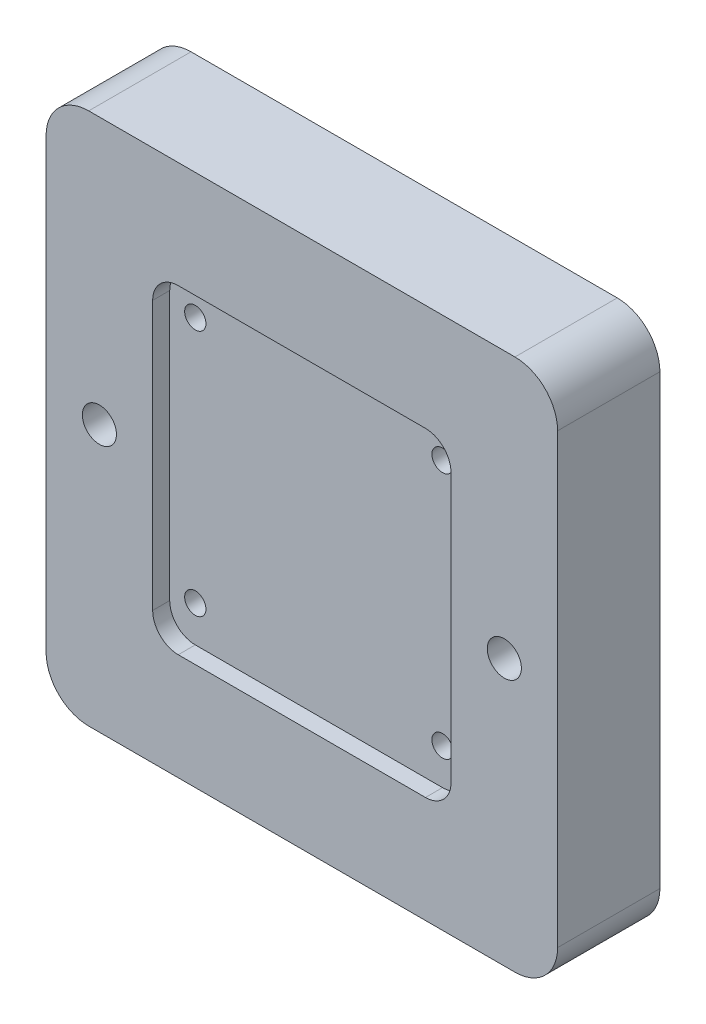
from build123d import *

# Parameters (mm, degrees)
BOSS_EXTRUDE1_DEPTH             = 4
BOSS_EXTRUDE2_DEPTH             = 20
F_8_0MM_DOWEL_HOLE1_D           = 8
F_8_0MM_DOWEL_HOLE1_DEPTH       = 18
F_8_0MM_DOWEL_HOLE1_TIP         = 2.403442476
TAP_DRILL_FOR_M6X1_0_TAP1_D     = 5
TAP_DRILL_FOR_M6X1_0_TAP1_DEPTH = 10
TAP_DRILL_FOR_M6X1_0_TAP1_TIP   = 1.502151548


with BuildPart() as part:
    # Sketch1 → Boss-Extrude1 (new body)
    with BuildSketch(Plane.XY):
        with BuildLine():
            Line((-50, 62.5), (50, 62.5))
            ThreePointArc((50, 62.5), (57.071067812, 59.571067812), (60, 52.5))
            Line((60, 52.5), (60, -52.5))
            ThreePointArc((60, -52.5), (57.071067812, -59.571067812), (50, -62.5))
            Line((50, -62.5), (-50, -62.5))
            ThreePointArc((-50, -62.5), (-57.071067812, -59.571067812), (-60, -52.5))
            Line((-60, -52.5), (-60, 52.5))
            ThreePointArc((-60, 52.5), (-57.071067812, 59.571067812), (-50, 62.5))
        make_face()
        with BuildLine():
            Line((-29, 37.5), (29, 37.5))
            ThreePointArc((29, 37.5), (33.242640687, 35.742640687), (35, 31.5))
            Line((35, 31.5), (35, -31.5))
            ThreePointArc((35, -31.5), (33.242640687, -35.742640687), (29, -37.5))
            Line((29, -37.5), (-29, -37.5))
            ThreePointArc((-29, -37.5), (-33.242640687, -35.742640687), (-35, -31.5))
            Line((-35, -31.5), (-35, 31.5))
            ThreePointArc((-35, 31.5), (-33.242640687, 35.742640687), (-29, 37.5))
        make_face(mode=Mode.SUBTRACT)
    extrude(amount=-BOSS_EXTRUDE1_DEPTH)

    # Sketch2 → Boss-Extrude2 (add)
    with BuildSketch(Plane.XY.offset(-4)):
        with BuildLine():
            Line((-50, -62.5), (50, -62.5))
            ThreePointArc((50, -62.5), (57.071067812, -59.571067812), (60, -52.5))
            Line((60, -52.5), (60, 52.5))
            ThreePointArc((60, 52.5), (57.071067812, 59.571067812), (50, 62.5))
            Line((50, 62.5), (-50, 62.5))
            ThreePointArc((-50, 62.5), (-57.071067812, 59.571067812), (-60, 52.5))
            Line((-60, 52.5), (-60, -52.5))
            ThreePointArc((-60, -52.5), (-57.071067812, -59.571067812), (-50, -62.5))
        make_face()
    extrude(amount=-BOSS_EXTRUDE2_DEPTH)

    # Ø8.0mm Dowel Hole1
    with Locations(Plane.XY):
        with Locations((-47.5, 0), (47.5, 0)):
            Hole(F_8_0MM_DOWEL_HOLE1_D / 2, depth=F_8_0MM_DOWEL_HOLE1_DEPTH)
            with Locations((0, 0, -(F_8_0MM_DOWEL_HOLE1_DEPTH + F_8_0MM_DOWEL_HOLE1_TIP / 2))):  # 118° drill point
                Cone(0, F_8_0MM_DOWEL_HOLE1_D / 2, F_8_0MM_DOWEL_HOLE1_TIP, mode=Mode.SUBTRACT)

    # Tap Drill for M6x1.0 Tap1
    with Locations(Plane.XY.offset(-4)):
        with Locations((-29, 29), (29, 29), (29, -29), (-29, -29)):
            Hole(TAP_DRILL_FOR_M6X1_0_TAP1_D / 2, depth=TAP_DRILL_FOR_M6X1_0_TAP1_DEPTH)
            with Locations((0, 0, -(TAP_DRILL_FOR_M6X1_0_TAP1_DEPTH + TAP_DRILL_FOR_M6X1_0_TAP1_TIP / 2))):  # 118° drill point
                Cone(0, TAP_DRILL_FOR_M6X1_0_TAP1_D / 2, TAP_DRILL_FOR_M6X1_0_TAP1_TIP, mode=Mode.SUBTRACT)


solid = part.part
